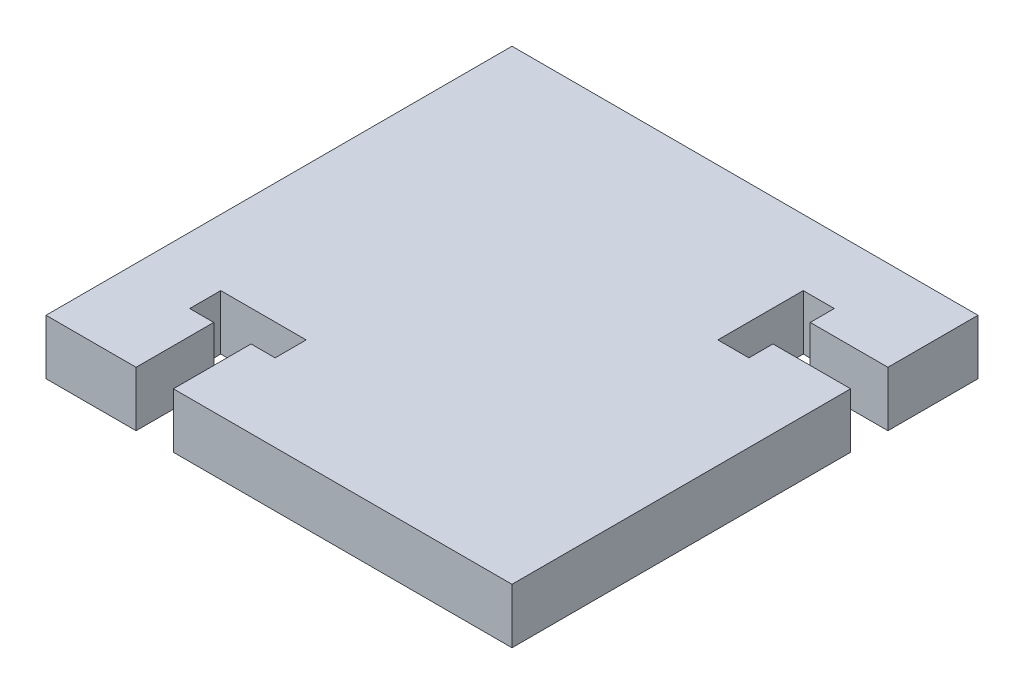
from build123d import *

# Parameters (mm, degrees)
BOSS_EXTRUDE1_DEPTH = 4.4958


with BuildPart() as part:
    # Sketch1 → Boss-Extrude1 (new body)
    with BuildSketch(Plane(origin=(0, 0, 0), x_dir=(1, 0, 0), z_dir=(0, 1, 0))):
        Polygon((-30.734, 0), (-30.734, 6.35), (-32.7025, 6.35), (-32.7025, 8.89), (-25.7175, 8.89), (-25.7175, 6.35), (-27.686, 6.35), (-27.686, 0), (0, 0), (0, 27.686), (-6.35, 27.686), (-6.35, 25.7175), (-8.89, 25.7175), (-8.89, 32.7025), (-6.35, 32.7025), (-6.35, 30.734), (0, 30.734), (0, 38.1), (-38.1, 38.1), (-38.1, 0), align=None)
    extrude(amount=BOSS_EXTRUDE1_DEPTH)


solid = part.part
